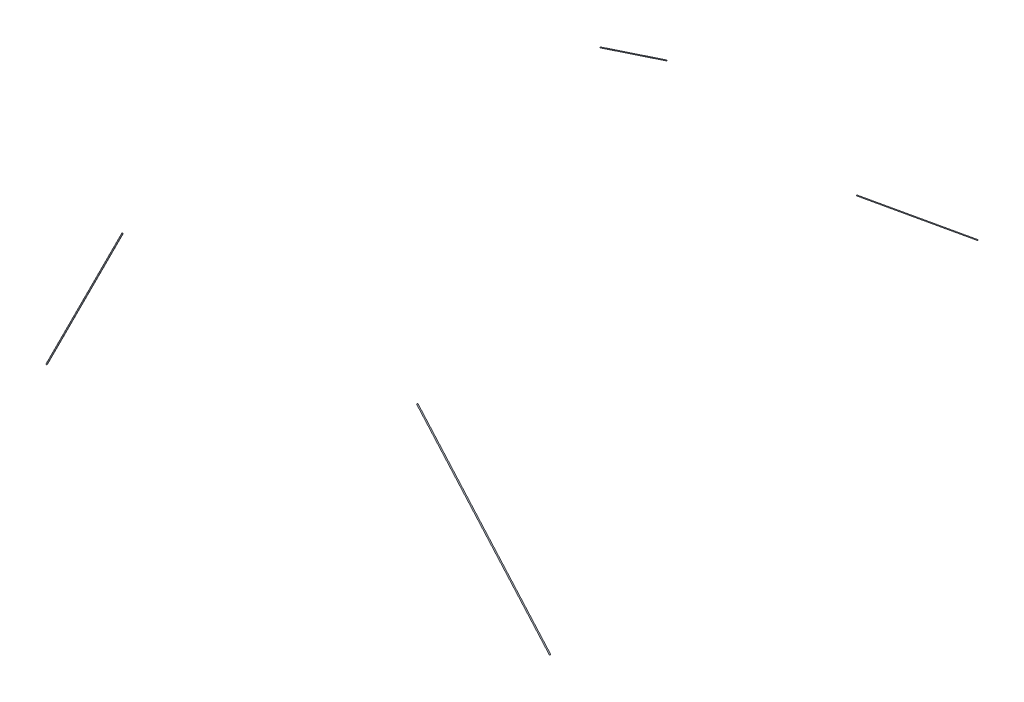
from build123d import *

# Parameters (mm, degrees)
SWEEP1_PROFILE_R = 0.79375
SWEEP2_PROFILE_R = 1.190625


with BuildPart() as part:
    # Sweep1: sweep along a curve in space
    with BuildLine() as sweep1_path:
        Line((346.49296881, 181.046899241, -995.14128647), (285.474604576, 341.137876825, -786.461297395))
    # Sweep1 profile (on start of the path) → Sweep1 (sweep)
    with BuildSketch(Plane(origin=(346.49296881, 181.046899241, -995.14128647), x_dir=(0, 0.7934172559813173, -0.6086781234043793), z_dir=(-0.22599440705348048, 0.5929307677784494, 0.7728904402321227))):
        Circle(SWEEP1_PROFILE_R)
    sweep(path=sweep1_path.line)


with BuildPart() as body_2:
    # Sweep2: sweep along a curve in space
    with BuildLine() as sweep2_path:
        Line((560.678896283, 71.512693637, 171.800144104), (328.382139821, 471.471432813, 235.469818078))
    # Sweep2 profile (on start of the path) → Sweep2 (sweep)
    with BuildSketch(Plane(origin=(560.678896283, 71.512693637, 171.800144104), x_dir=(0.8647301218365276, 0.5022368130559369, 0), z_dir=(-0.4975448418495522, 0.856651684080714, 0.13637090052713177))):
        Circle(SWEEP2_PROFILE_R)
    sweep(path=sweep2_path.line)


with BuildPart() as body_3:
    # Mirror1: mirrored copy
    add(part.part.mirror(Plane(origin=(0, 0, 0), x_dir=(0, 0, 1), z_dir=(1, 0, 0))))


with BuildPart() as body_4:
    # Mirror1 2: mirrored copy
    add(body_2.part.mirror(Plane(origin=(0, 0, 0), x_dir=(0, 0, 1), z_dir=(1, 0, 0))))


solid = Compound([part.part, body_2.part, body_3.part, body_4.part])
